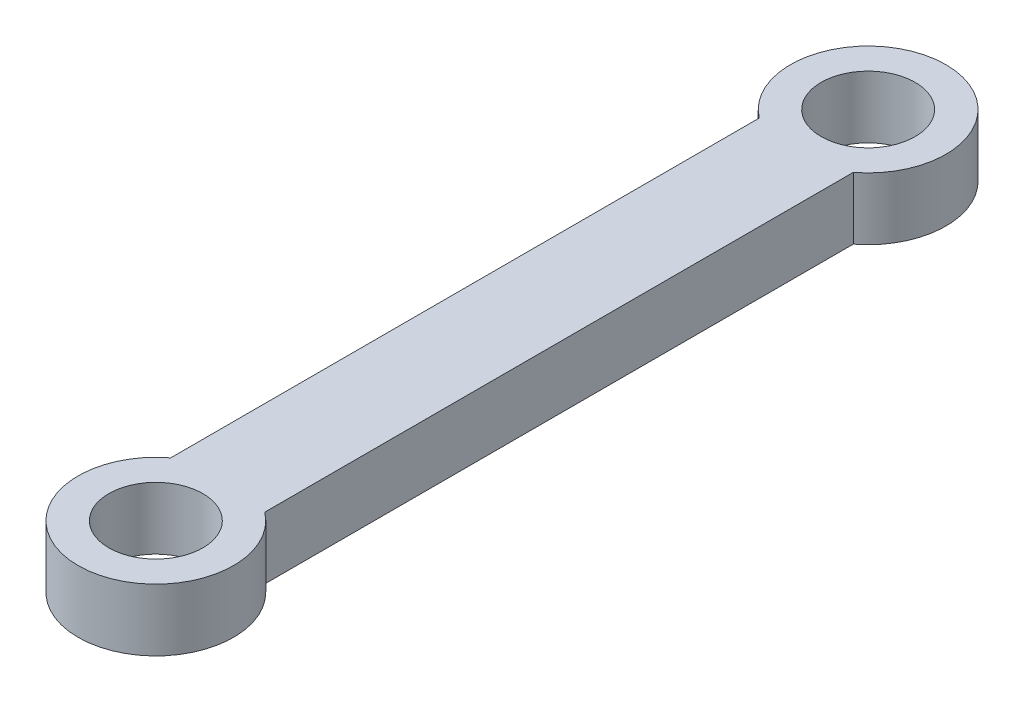
from build123d import *

# Parameters (mm, degrees)
SKETCH1_R           = 3.025
BOSS_EXTRUDE1_DEPTH = 4


with BuildPart() as part:
    # Sketch1 → Boss-Extrude1 (new body)
    with BuildSketch(Plane(origin=(0, 0, 0), x_dir=(1, 0, 0), z_dir=(0, 1, 0))):
        with BuildLine():
            Line((-3.025, 41.838872647), (-3.025, 3.981127353))
            ThreePointArc((-3.025, 3.981127353), (0, -5), (3.025, 3.981127353))
            Line((3.025, 3.981127353), (3.025, 41.838872647))
            ThreePointArc((3.025, 41.838872647), (0, 50.82), (-3.025, 41.838872647))
        make_face()
        with Locations((0, 45.82)):
            Circle(SKETCH1_R, mode=Mode.SUBTRACT)
        Circle(SKETCH1_R, mode=Mode.SUBTRACT)
    extrude(amount=BOSS_EXTRUDE1_DEPTH)


solid = part.part
